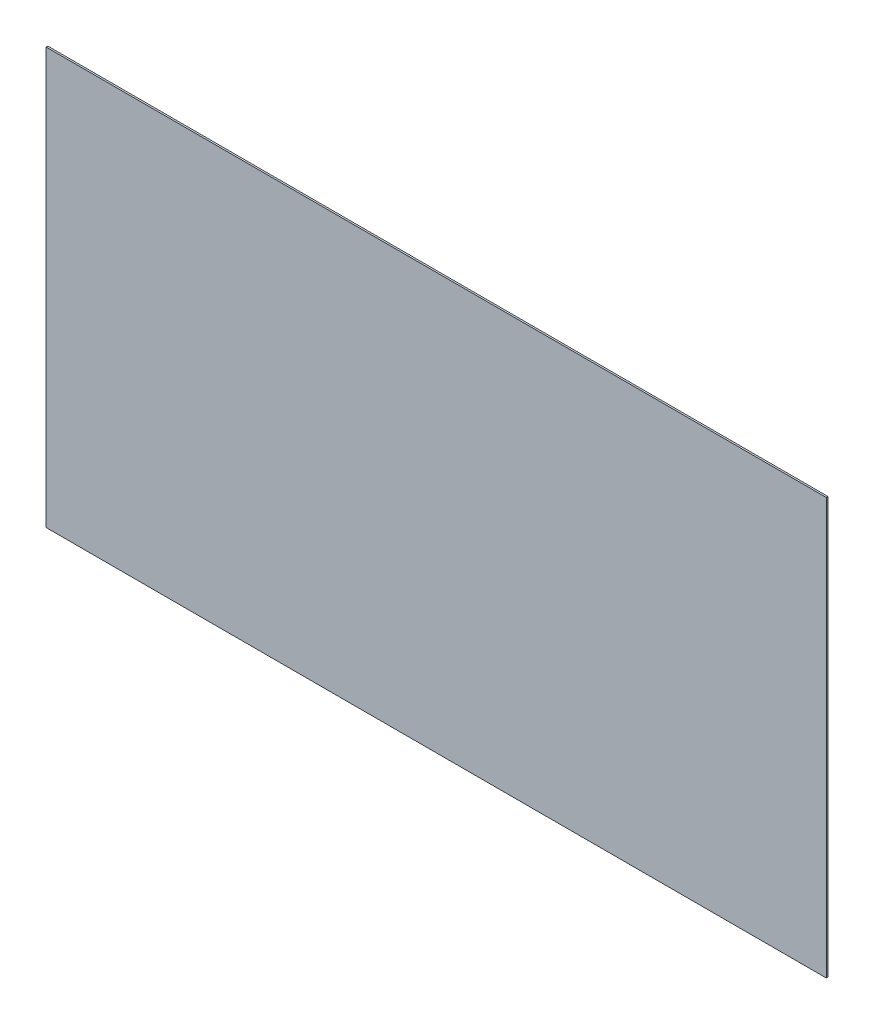
from build123d import *

# Parameters (mm, degrees)
SKETCH1_W           = 450
SKETCH1_H           = 240
BOSS_EXTRUDE1_DEPTH = 1


with BuildPart() as part:
    # Sketch1 → Boss-Extrude1 (new body)
    with BuildSketch(Plane.XY):
        Rectangle(SKETCH1_W, SKETCH1_H)
    extrude(amount=BOSS_EXTRUDE1_DEPTH)


solid = part.part
